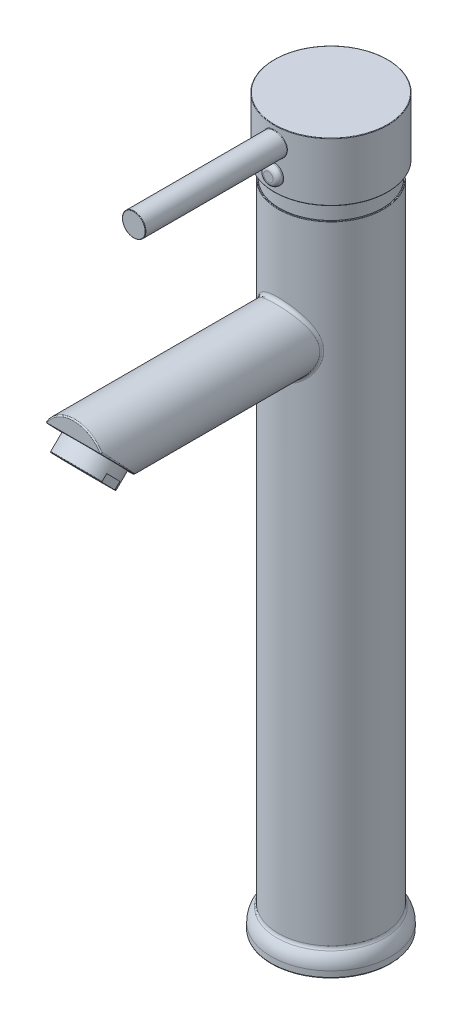
from build123d import *
from build123d.topology import SkipClean

# Parameters (mm, degrees)
CROQUIS1_R                               = 22.5
SALIENTE_EXTRUIR1_DEPTH                  = 285
CROQUIS2_R                               = 25.5
SALIENTE_EXTRUIR2_DEPTH                  = 9
CROQUIS3_OUTSIDE_W                       = 113.544
CROQUIS3_OUTSIDE_H                       = 113.544
CROQUIS3_OUTSIDE_R                       = 22
CORTAR_EXTRUIR1_DEPTH                    = 16
REDONDEO1_R                              = 10
REDONDEO2_R                              = 8
REDONDEO3_R                              = 2
REDONDEO4_R                              = 0.3
REDONDEO5_R                              = 0.2
CROQUIS4_R                               = 13.75
SALIENTE_EXTRUIR3_DEPTH                  = 110
CORTAR_EXTRUIR2_START                    = -15
CORTAR_EXTRUIR2_DEPTH                    = 30
CROQUIS6_R                               = 11.5
SALIENTE_EXTRUIR4_DEPTH                  = 7
VACIADO1_T                               = -1.5
CORTAR_EXTRUIR3_DEPTH                    = 3
CROQUIS10_R                              = 7.770937418
CROQUIS10_R_2                            = 7.570937418
CROQUIS10_R_3                            = 5.975707381
CROQUIS10_R_4                            = 5.775707381
CROQUIS10_R_5                            = 4.19027449
CROQUIS10_R_6                            = 3.99027449
CROQUIS10_R_7                            = 2.027045597
CROQUIS10_R_8                            = 1.827045597
CROQUIS10_W                              = 0.2
CROQUIS10_H                              = 7.072954403
CROQUIS10_W_2                            = 7.072954403
CROQUIS10_H_2                            = 0.2
EXTRUIR_L_MINA1_DEPTH                    = 5
EXTRUIR_L_MINA2_OUTLINE_R                = 9.8
EXTRUIR_L_MINA2_OUTLINE_R_2              = 9
EXTRUIR_L_MINA2_DEPTH                    = 5
CROQUIS11_R                              = 24.25
SALIENTE_EXTRUIR5_DEPTH                  = 25
VACIADO2_T                               = -1
CROQUIS12_R                              = 5
SALIENTE_EXTRUIR6_DEPTH                  = 60
SALIENTE_EXTRUIR6_DIRECTION_2_REACH      = 317.119
SALIENTE_EXTRUIR6_DIRECTION_2_END_RADIUS = 24.25
CROQUIS13_R                              = 4
SALIENTE_EXTRUIR7_DEPTH                  = 2.5
REDONDEO6_R                              = 2
REDONDEO7_R                              = 0.2
REDONDEO8_R                              = 1.5
REDONDEO9_R                              = 0.5
REDONDEO10_R                             = 0.2


with BuildPart() as part:
    # Croquis1 → Saliente-Extruir1 (new body)
    with BuildSketch(Plane(origin=(0, 0, 0), x_dir=(1, 0, 0), z_dir=(0, 1, 0))):
        with Locations(Location((0, 0, 0), (0, 0, 270))):
            Circle(CROQUIS1_R)
    extrude(amount=SALIENTE_EXTRUIR1_DEPTH)

    # Croquis2 → Saliente-Extruir2 (add)
    with BuildSketch(Plane.XZ):
        with Locations(Location((0, 0, 0), (0, 0, 270))):
            Circle(CROQUIS2_R)
    extrude(amount=SALIENTE_EXTRUIR2_DEPTH)

    # Croquis3 outside → Cortar-Extruir1 (cut)
    with BuildSketch(Plane(origin=(0, 285, 0), x_dir=(1, 0, 0), z_dir=(0, 1, 0))):
        Rectangle(CROQUIS3_OUTSIDE_W, CROQUIS3_OUTSIDE_H)
        with Locations(Location((0, 0, 0), (0, 0, 270))):
            Circle(CROQUIS3_OUTSIDE_R, mode=Mode.SUBTRACT)
    extrude(amount=-CORTAR_EXTRUIR1_DEPTH, mode=Mode.SUBTRACT)

    # Redondeo1
    redondeo1_edges = [part.edges().sort_by_distance(p)[0] for p in [
        (0, 285, -22),
    ]]
    fillet(redondeo1_edges, radius=REDONDEO1_R)

    # Redondeo2
    # the kernel refuses this fillet: 8 mm, written as the material it takes off along each edge
    with BuildSketch(Plane(origin=(0, 0, 0), x_dir=(0, 0, -1), z_dir=(-1, 0, 0))) as redondeo2_piece_1:
        with BuildLine():
            CenterArc((17.5, 6.244997998), REDONDEO2_R, 308.682187453, 51.317812547)
            Line((25.5, 6.244997998), (25.66, 6.244997998))
            Line((25.66, 6.244997998), (25.66, 0))
            Line((25.66, 0), (25.5, -0.16))
            ThreePointArc((25.5, -0.16), (24, -0.16), (22.6, -0.12489996))
            Line((22.6, -0.12489996), (22.5, 0))
        make_face()
    revolve(axis=Axis((0, 0, 0), (0, -1, 0)), mode=Mode.SUBTRACT)

    # Redondeo3
    redondeo3_edges = [part.edges().sort_by_distance(p)[0] for p in [
        (22.5, 0, 0),
    ]]
    fillet(redondeo3_edges, radius=REDONDEO3_R)

    # Redondeo4
    redondeo4_edges = [part.edges().sort_by_distance(p)[0] for p in [
        (0, -9, 25.5),
    ]]
    fillet(redondeo4_edges, radius=REDONDEO4_R)

    # Redondeo5
    redondeo5_edges = [part.edges().sort_by_distance(p)[0] for p in [
        (0, 269, -22.5),
    ]]
    fillet(redondeo5_edges, radius=REDONDEO5_R)

    # Croquis4 → Saliente-Extruir3 (add)
    with BuildSketch(Plane.XY):
        with Locations(Location((0, 221, 0), (0, 0, 180))):
            Circle(CROQUIS4_R)
    extrude(amount=SALIENTE_EXTRUIR3_DEPTH)

    # Cortar-Extruir2: read off the stored shape, not the designer's step
    # Cortar-Extruir2 outline → Cortar-Extruir2 (cut)
    with BuildSketch(Plane(origin=(0, 0, 0), x_dir=(0, 0, -1), z_dir=(1, 0, 0)).offset(CORTAR_EXTRUIR2_START)):
        Polygon((-88.780487805, 206), (-90, 207.25), (-110, 227.75), (-110, 206), align=None)
    extrude(amount=CORTAR_EXTRUIR2_DEPTH, mode=Mode.SUBTRACT)

    # Redondeo8
    redondeo8_edges = [part.edges().sort_by_distance(p)[0] for p in [
        (13.75, 221, 17.809758561),
    ]]
    fillet(redondeo8_edges, radius=REDONDEO8_R)

    # Redondeo9
    redondeo9_edges = [part.edges().sort_by_distance(p)[0] for p in [
        (0, 234.75, 110),
        (0, 227.75, 110),
        (12.477425878, 215.222773722, 97.778315826),
    ]]
    fillet(redondeo9_edges, radius=REDONDEO9_R)


with BuildPart() as body_2:
    # Croquis6 → Saliente-Extruir4 (new body)
    with BuildSketch(Plane(origin=(0, 56.080463273, -57.482474855), x_dir=(1, 0, 0), z_dir=(0, -0.6983238520753272, 0.7157819483772112))):
        with Locations(Location((0, 226.834962471, 0), (0, 0, 270))):
            Circle(CROQUIS6_R)
    extrude(amount=SALIENTE_EXTRUIR4_DEPTH)

    # Vaciado1
    vaciado1_openings = [body_2.faces().sort_by_distance(p)[0] for p in [
        (0, 213.556567707, 105.932263562),
    ]]
    offset(amount=VACIADO1_T, openings=vaciado1_openings, kind=Kind.INTERSECTION)

    # Croquis8 → Cortar-Extruir3 (cut)
    with BuildSketch(Plane(origin=(0, 51.192196309, -52.472001217), x_dir=(1, 0, 0), z_dir=(0, -0.6983238520753272, 0.7157819483772111))):
        with BuildLine():
            Line((-10.781929326, 222.834962471), (-10.781929326, 230.834962471))
            ThreePointArc((-10.781929326, 230.834962471), (-11.5, 226.834962471), (-10.781929326, 222.834962471))
        make_face()
        with BuildLine():
            Line((10.781929326, 222.834962471), (10.781929326, 230.834962471))
            ThreePointArc((10.781929326, 230.834962471), (11.5, 226.834962471), (10.781929326, 222.834962471))
        make_face()
    extrude(amount=-CORTAR_EXTRUIR3_DEPTH, mode=Mode.SUBTRACT)

    # Redondeo10
    redondeo10_edges = [body_2.edges().sort_by_distance(p)[0] for p in [
        (0, 220.71438719, 112.915502082),
        (0, 221.788060113, 113.962987861),
        (6.566962768, 206.799153929, 99.339664754),
    ]]
    fillet(redondeo10_edges, radius=REDONDEO10_R)


with BuildPart() as body_3:
    # Croquis10 → Extruir-Lámina1 (new body)
    # profile 1 of 24: a face of its own
    with BuildSketch(Plane(origin=(0, 55.032977495, -56.408801933), x_dir=(1, 0, 0), z_dir=(0, -0.6983238520753272, 0.7157819483772111))):
        with Locations((0, 226.834962471)):
            Circle(CROQUIS10_R)
        with Locations((0, 226.834962471)):
            Circle(CROQUIS10_R_2, mode=Mode.SUBTRACT)
    # profile 2 of 24: a face of its own
    with BuildSketch(Plane(origin=(0, 55.032977495, -56.408801933), x_dir=(1, 0, 0), z_dir=(0, -0.6983238520753272, 0.7157819483772111))):
        with Locations((0, 226.834962471)):
            Circle(CROQUIS10_R_3)
        with Locations((0, 226.834962471)):
            Circle(CROQUIS10_R_4, mode=Mode.SUBTRACT)
    # profile 3 of 24: a face of its own
    with BuildSketch(Plane(origin=(0, 55.032977495, -56.408801933), x_dir=(1, 0, 0), z_dir=(0, -0.6983238520753272, 0.7157819483772111))):
        with Locations((0, 226.834962471)):
            Circle(CROQUIS10_R_5)
        with Locations((0, 226.834962471)):
            Circle(CROQUIS10_R_6, mode=Mode.SUBTRACT)
    # profile 4 of 24: a face of its own
    with BuildSketch(Plane(origin=(0, 55.032977495, -56.408801933), x_dir=(1, 0, 0), z_dir=(0, -0.6983238520753272, 0.7157819483772111))):
        with Locations((0, 226.834962471)):
            Circle(CROQUIS10_R_7)
        with Locations((0, 226.834962471)):
            Circle(CROQUIS10_R_8, mode=Mode.SUBTRACT)
    # profile 5 of 24: a face of its own
    with BuildSketch(Plane(origin=(0, 55.032977495, -56.408801933), x_dir=(1, 0, 0), z_dir=(0, -0.6983238520753272, 0.7157819483772111))):
        with Locations((0, 232.29848527)):
            Rectangle(CROQUIS10_W, CROQUIS10_H)
    # profile 6 of 24: a face of its own
    with BuildSketch(Plane(origin=(0, 55.032977495, -56.408801933), x_dir=(1, 0, 0), z_dir=(0, -0.6983238520753272, 0.7157819483772111))):
        Polygon((0.69059549, 228.636790044), (2.876258601, 235.363569418), (2.686047298, 235.425372817), (0.500384187, 228.698593443), align=None)
    # profile 7 of 24: a face of its own
    with BuildSketch(Plane(origin=(0, 55.032977495, -56.408801933), x_dir=(1, 0, 0), z_dir=(0, -0.6983238520753272, 0.7157819483772111))):
        Polygon((1.213590682, 228.335196583), (5.37096897, 234.057336895), (5.209165571, 234.174893946), (1.051787283, 228.452753633), align=None)
    # profile 8 of 24: a face of its own
    with BuildSketch(Plane(origin=(0, 55.032977495, -56.408801933), x_dir=(1, 0, 0), z_dir=(0, -0.6983238520753272, 0.7157819483772111))):
        Polygon((1.617791162, 227.886749754), (7.339931475, 232.044128042), (7.222374424, 232.205931441), (1.500234112, 228.048553153), align=None)
    # profile 9 of 24: a face of its own
    with BuildSketch(Plane(origin=(0, 55.032977495, -56.408801933), x_dir=(1, 0, 0), z_dir=(0, -0.6983238520753272, 0.7157819483772111))):
        Polygon((1.863630972, 227.335346658), (8.590410346, 229.521009769), (8.528606947, 229.711221072), (1.801827573, 227.525557961), align=None)
    # profile 10 of 24: a face of its own
    with BuildSketch(Plane(origin=(0, 55.032977495, -56.408801933), x_dir=(1, 0, 0), z_dir=(0, -0.6983238520753272, 0.7157819483772111))):
        with Locations((5.463522798, 226.834962471)):
            Rectangle(CROQUIS10_W_2, CROQUIS10_H_2)
    # profile 11 of 24: a face of its own
    with BuildSketch(Plane(origin=(0, 55.032977495, -56.408801933), x_dir=(1, 0, 0), z_dir=(0, -0.6983238520753272, 0.7157819483772111))):
        Polygon((1.801827573, 226.144366981), (8.528606947, 223.95870387), (8.590410346, 224.148915173), (1.863630972, 226.334578284), align=None)
    # profile 12 of 24: a face of its own
    with BuildSketch(Plane(origin=(0, 55.032977495, -56.408801933), x_dir=(1, 0, 0), z_dir=(0, -0.6983238520753272, 0.7157819483772111))):
        Polygon((1.500234112, 225.621371789), (7.222374424, 221.463993501), (7.339931475, 221.6257969), (1.617791162, 225.783175188), align=None)
    # profile 13 of 24: a face of its own
    with BuildSketch(Plane(origin=(0, 55.032977495, -56.408801933), x_dir=(1, 0, 0), z_dir=(0, -0.6983238520753272, 0.7157819483772111))):
        Polygon((1.051787283, 225.217171309), (5.209165571, 219.495030997), (5.37096897, 219.612588047), (1.213590682, 225.334728359), align=None)
    # profile 14 of 24: a face of its own
    with BuildSketch(Plane(origin=(0, 55.032977495, -56.408801933), x_dir=(1, 0, 0), z_dir=(0, -0.6983238520753272, 0.7157819483772111))):
        Polygon((0.500384187, 224.971331499), (2.686047298, 218.244552125), (2.876258601, 218.306355524), (0.69059549, 225.033134898), align=None)
    # profile 15 of 24: a face of its own
    with BuildSketch(Plane(origin=(0, 55.032977495, -56.408801933), x_dir=(1, 0, 0), z_dir=(0, -0.6983238520753272, 0.7157819483772111))):
        with Locations((0, 221.371439673)):
            Rectangle(CROQUIS10_W, CROQUIS10_H)
    # profile 16 of 24: a face of its own
    with BuildSketch(Plane(origin=(0, 55.032977495, -56.408801933), x_dir=(1, 0, 0), z_dir=(0, -0.6983238520753272, 0.7157819483772111))):
        Polygon((-0.69059549, 225.033134898), (-2.876258601, 218.306355524), (-2.686047298, 218.244552125), (-0.500384187, 224.971331499), align=None)
    # profile 17 of 24: a face of its own
    with BuildSketch(Plane(origin=(0, 55.032977495, -56.408801933), x_dir=(1, 0, 0), z_dir=(0, -0.6983238520753272, 0.7157819483772111))):
        Polygon((-1.213590682, 225.334728359), (-5.37096897, 219.612588047), (-5.209165571, 219.495030997), (-1.051787283, 225.217171309), align=None)
    # profile 18 of 24: a face of its own
    with BuildSketch(Plane(origin=(0, 55.032977495, -56.408801933), x_dir=(1, 0, 0), z_dir=(0, -0.6983238520753272, 0.7157819483772111))):
        Polygon((-1.617791162, 225.783175188), (-7.339931475, 221.6257969), (-7.222374424, 221.463993501), (-1.500234112, 225.621371789), align=None)
    # profile 19 of 24: a face of its own
    with BuildSketch(Plane(origin=(0, 55.032977495, -56.408801933), x_dir=(1, 0, 0), z_dir=(0, -0.6983238520753272, 0.7157819483772111))):
        Polygon((-1.863630972, 226.334578284), (-8.590410346, 224.148915173), (-8.528606947, 223.95870387), (-1.801827573, 226.144366981), align=None)
    # profile 20 of 24: a face of its own
    with BuildSketch(Plane(origin=(0, 55.032977495, -56.408801933), x_dir=(1, 0, 0), z_dir=(0, -0.6983238520753272, 0.7157819483772111))):
        with Locations((-5.463522798, 226.834962471)):
            Rectangle(CROQUIS10_W_2, CROQUIS10_H_2)
    # profile 21 of 24: a face of its own
    with BuildSketch(Plane(origin=(0, 55.032977495, -56.408801933), x_dir=(1, 0, 0), z_dir=(0, -0.6983238520753272, 0.7157819483772111))):
        Polygon((-1.801827573, 227.525557961), (-8.528606947, 229.711221072), (-8.590410346, 229.521009769), (-1.863630972, 227.335346658), align=None)
    # profile 22 of 24: a face of its own
    with BuildSketch(Plane(origin=(0, 55.032977495, -56.408801933), x_dir=(1, 0, 0), z_dir=(0, -0.6983238520753272, 0.7157819483772111))):
        Polygon((-1.500234112, 228.048553153), (-7.222374424, 232.205931441), (-7.339931475, 232.044128042), (-1.617791162, 227.886749754), align=None)
    # profile 23 of 24: a face of its own
    with BuildSketch(Plane(origin=(0, 55.032977495, -56.408801933), x_dir=(1, 0, 0), z_dir=(0, -0.6983238520753272, 0.7157819483772111))):
        Polygon((-1.051787283, 228.452753633), (-5.209165571, 234.174893946), (-5.37096897, 234.057336895), (-1.213590682, 228.335196583), align=None)
    # profile 24 of 24: a face of its own
    with BuildSketch(Plane(origin=(0, 55.032977495, -56.408801933), x_dir=(1, 0, 0), z_dir=(0, -0.6983238520753272, 0.7157819483772111))):
        Polygon((-0.500384187, 228.698593443), (-2.686047298, 235.425372817), (-2.876258601, 235.363569418), (-0.69059549, 228.636790044), align=None)
    extrude(amount=EXTRUIR_L_MINA1_DEPTH)


with BuildPart() as body_4:
    # Extruir-Lámina2: read off the stored shape, not the designer's step
    # Extruir-Lámina2 outline → Extruir-Lámina2 (new body)
    with BuildSketch(Plane(origin=(0, 55.032977495, -56.408801933), x_dir=(1, 0, 0), z_dir=(0, -0.6983238520753272, 0.7157819483772111))):
        with Locations((0, 226.834962471)):
            Circle(EXTRUIR_L_MINA2_OUTLINE_R)
        with Locations((0, 226.834962471)):
            Circle(EXTRUIR_L_MINA2_OUTLINE_R_2, mode=Mode.SUBTRACT)
    extrude(amount=EXTRUIR_L_MINA2_DEPTH)


with BuildPart() as body_5:
    # Croquis11 → Saliente-Extruir5 (new body)
    with BuildSketch(Plane(origin=(0, 276, 0), x_dir=(1, 0, 0), z_dir=(0, 1, 0))):
        with Locations(Location((0, 0, 0), (0, 0, 270))):
            Circle(CROQUIS11_R)
    extrude(amount=SALIENTE_EXTRUIR5_DEPTH)

    # Vaciado2
    vaciado2_openings = [body_5.faces().sort_by_distance(p)[0] for p in [
        (0, 276, 0),
    ]]
    offset(amount=VACIADO2_T, openings=vaciado2_openings, kind=Kind.INTERSECTION)

    # Croquis12 → Saliente-Extruir6 (add)
    with BuildSketch(Plane.XY.offset(24.25)):
        with Locations(Location((0, 294, 0), (0, 0, 180))):
            Circle(CROQUIS12_R)
    extrude(amount=SALIENTE_EXTRUIR6_DEPTH)

    # Saliente-Extruir6 direction 2: up to this cylinder (the profile starts outside it)
    with SkipClean():  # the faces are left unmerged after this step: merging them gives an invalid solid
        saliente_extruir6_direction_2_end = Plane(origin=(0, 294, 0), z_dir=(0, -1, 0)) * Cylinder(SALIENTE_EXTRUIR6_DIRECTION_2_END_RADIUS, 683.738, mode=Mode.PRIVATE)
        # Croquis12 → Saliente-Extruir6 direction 2 (add, up to the surface)
        with BuildSketch(Plane.XY.offset(24.25), mode=Mode.PRIVATE) as saliente_extruir6_direction_2_sk1:
            with Locations(Location((0, 294, 0), (0, 0, 180))):
                Circle(CROQUIS12_R)
        saliente_extruir6_direction_2_tool1 = extrude(saliente_extruir6_direction_2_sk1.sketch, amount=-SALIENTE_EXTRUIR6_DIRECTION_2_REACH, mode=Mode.PRIVATE) - saliente_extruir6_direction_2_end
        add(saliente_extruir6_direction_2_tool1.solids().sort_by_distance((0, 294, 24.25))[0])
        add(saliente_extruir6_direction_2_tool1.solids().sort_by_distance((0, 294, 24.25))[1])

    # Redondeo7
    redondeo7_edges = [body_5.edges().sort_by_distance(p)[0] for p in [
        (5, 294, 84.25),
        (0, 276, -24.25),
        (0, 301, -24.25),
        (0, 276, -23.25),
        (5, 294, 23.728938029),
    ]]
    fillet(redondeo7_edges, radius=REDONDEO7_R)


with BuildPart() as body_6:
    # Croquis13 → Saliente-Extruir7 (new body)
    with BuildSketch(Plane.XY.offset(24.25)):
        with Locations((0, 283)):
            Circle(CROQUIS13_R)
    extrude(amount=SALIENTE_EXTRUIR7_DEPTH)

    # Redondeo6
    redondeo6_edges = [body_6.edges().sort_by_distance(p)[0] for p in [
        (-4, 283, 26.75),
    ]]
    fillet(redondeo6_edges, radius=REDONDEO6_R)


solid = Compound([part.part, body_2.part, body_3.part, body_4.part, body_5.part, body_6.part])
